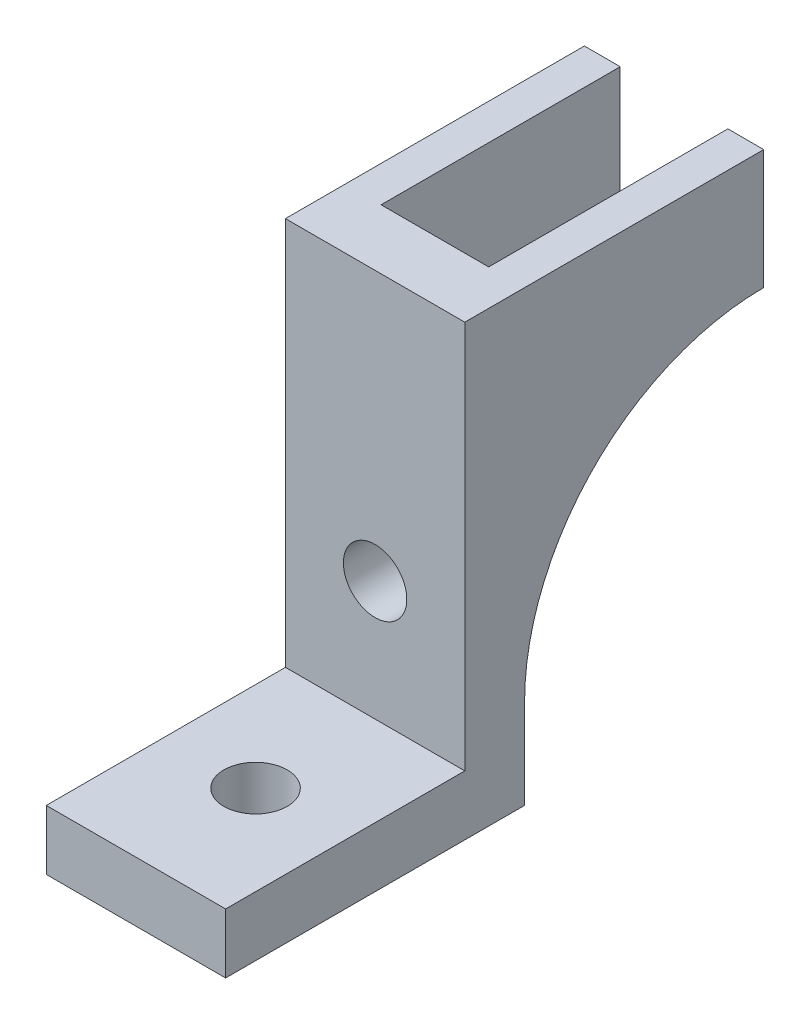
from build123d import *

# Parameters (mm, degrees)
SKETCH2_W           = 15
SKETCH2_H           = 37.5
BOSS_EXTRUDE1_DEPTH = 5
SKETCH3_W           = 15
SKETCH3_H           = 5
BOSS_EXTRUDE2_DEPTH = 20
SKETCH4_W           = 3
SKETCH4_H           = 10
BOSS_EXTRUDE3_DEPTH = 20
FILLET1_R           = 20
SKETCH6_R           = 2.65
CUT_EXTRUDE2_DEPTH  = 10
SKETCH7_R           = 2.65
CUT_EXTRUDE3_DEPTH  = 10


with BuildPart() as part:
    # Sketch2 → Boss-Extrude1 (new body)
    with BuildSketch(Plane.XY):
        with Locations((7.5, 18.75)):
            Rectangle(SKETCH2_W, SKETCH2_H)
    extrude(amount=BOSS_EXTRUDE1_DEPTH)

    # Sketch3 → Boss-Extrude2 (add)
    with BuildSketch(Plane.XY.offset(5)):
        with Locations((7.5, 2.5)):
            Rectangle(SKETCH3_W, SKETCH3_H)
    extrude(amount=BOSS_EXTRUDE2_DEPTH)

    # Sketch4 → Boss-Extrude3 (add)
    with BuildSketch(Plane(origin=(0, 0, 0), x_dir=(-1, 0, 0), z_dir=(0, 0, -1))):
        with Locations((-13.5, 32.5)):
            Rectangle(SKETCH4_W, SKETCH4_H)
        with Locations((-1.5, 32.5)):
            Rectangle(SKETCH4_W, SKETCH4_H)
    extrude(amount=BOSS_EXTRUDE3_DEPTH)

    # Fillet1
    fillet1_edges = [part.edges().sort_by_distance(p)[0] for p in [
        (1.5, 27.5, 0),
        (13.5, 27.5, 0),
    ]]
    fillet(fillet1_edges, radius=FILLET1_R - 0.0001)  # a hair under: the kernel refuses the full size

    # Sketch6 → Cut-Extrude2 (cut)
    with BuildSketch(Plane.XZ):
        with Locations(Location((7.5, 15, 0), (0, 0, 270))):
            Circle(SKETCH6_R)
    extrude(amount=-CUT_EXTRUDE2_DEPTH, mode=Mode.SUBTRACT)

    # Sketch7 → Cut-Extrude3 (cut)
    with BuildSketch(Plane(origin=(0, 0, 0), x_dir=(-1, 0, 0), z_dir=(0, 0, -1))):
        with Locations((-7.5, 15)):
            Circle(SKETCH7_R)
    extrude(amount=-CUT_EXTRUDE3_DEPTH, mode=Mode.SUBTRACT)


solid = part.part
